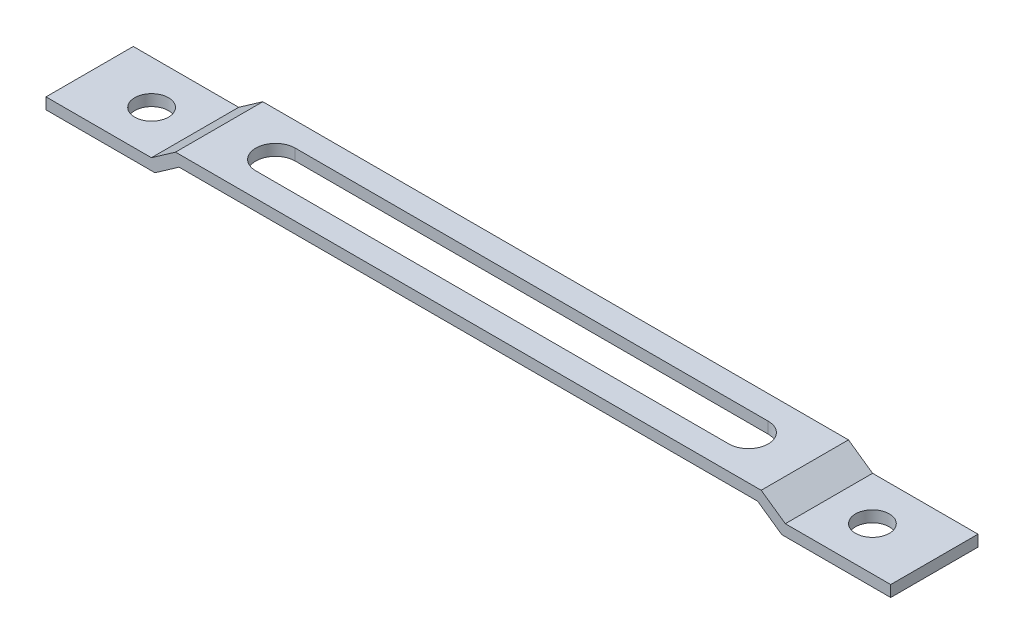
from build123d import *

# Parameters (mm, degrees)
EXTRUDE_1_DEPTH     = 15.5
SKETCH_2_R          = 3
CUT_EXTRUDE_1_DEPTH = 10


with BuildPart() as part:
    # Эскиз1 → Вытянуть-Тонкостенный1 (new body)
    with BuildSketch(Plane.XY):
        Polygon((75, 0), (56.28444402, 0), (52, 3), (-52, 3), (-56.28444402, 0), (-75, 0), (-75, -2), (-55.653846442, -2), (-51.369402422, 1), (51.369402422, 1), (55.653846442, -2), (75, -2), align=None)
    extrude(amount=EXTRUDE_1_DEPTH)

    # Эскиз2 → Вырез-Вытянуть1 (cut)
    with BuildSketch(Plane(origin=(0, 3, 0), x_dir=(1, 0, 0), z_dir=(0, 1, 0))):
        with Locations((-64, -7.75)):
            Circle(SKETCH_2_R)
        with Locations((64, -7.75)):
            Circle(SKETCH_2_R)
        with BuildLine():
            Line((-42, -4.25), (42, -4.25))
            ThreePointArc((42, -4.25), (45.5, -7.75), (42, -11.25))
            Line((42, -11.25), (-42, -11.25))
            ThreePointArc((-42, -11.25), (-45.5, -7.75), (-42, -4.25))
        make_face()
    extrude(amount=-CUT_EXTRUDE_1_DEPTH, mode=Mode.SUBTRACT)


solid = part.part
